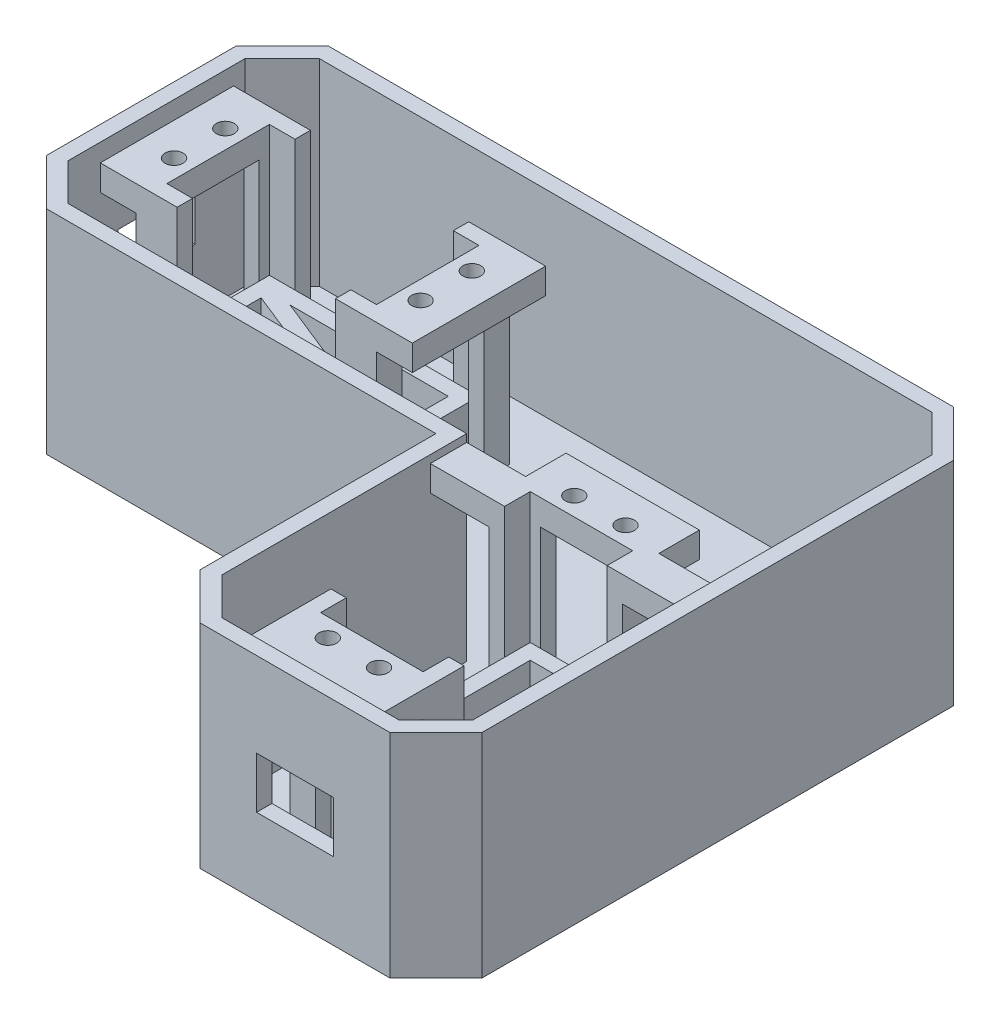
from build123d import *

# Parameters (mm, degrees)
BOSS_EXTRUDE1_DEPTH     = 55
SHELL1_START            = 3
SHELL1_DEPTH            = 49
CUT_EXTRUDE1_DEPTH      = 161.15617378
CUT_EXTRUDE1_DEPTH_BACK = 161.15617378
SKETCH4_W               = 154.651671352
SKETCH4_H               = 22.597591031
SKETCH6_R               = 3.8
BOSS_EXTRUDE2_DEPTH     = 6
BOSS_EXTRUDE3_DEPTH     = 37
SKETCH9_W               = 26
SKETCH9_H               = 10
BOSS_EXTRUDE4_DEPTH     = 5
CUT_EXTRUDE3_REACH      = 159.293
SKETCH10_R              = 1.75
SKETCH11_W              = 26
SKETCH11_H              = 2
SKETCH11_W_2            = 11.5
SKETCH11_H_2            = 7.1
BOSS_EXTRUDE5_DEPTH     = 5
CUT_EXTRUDE4_REACH      = 184.818
SKETCH12_W              = 15
SKETCH12_H              = 10
SKETCH13_W              = 20
SKETCH13_H              = 40.9
BOSS_EXTRUDE6_DEPTH     = 11.5
CUT_EXTRUDE5_DEPTH      = 11.5
BOSS_EXTRUDE7_DEPTH     = 11.5
CUT_EXTRUDE6_REACH      = 158.036
SKETCH16_W              = 15
SKETCH16_H              = 10
BOSS_EXTRUDE8_DEPTH     = 37
BOSS_EXTRUDE9_DEPTH     = 5
SKETCH20_W              = 40.9
SKETCH20_H              = 20
BOSS_EXTRUDE10_DEPTH    = 11.5
CUT_EXTRUDE7_DEPTH      = 11.5


# Read off the part's stored shape, not the designer's step: Shell1
with BuildPart() as part:
    # Sketch2 → Boss-Extrude1 (new body)
    with BuildSketch(Plane(origin=(0, 0, 0), x_dir=(1, 0, 0), z_dir=(0, 1, 0))):
        Polygon((9, 55), (0, 46), (0, 9), (9, 0), (85, 0), (140, 0), (140, 46), (131, 55), align=None)
        Polygon((140, 0), (85, 0), (85, -46), (94, -55), (131, -55), (140, -46), align=None)
    extrude(amount=BOSS_EXTRUDE1_DEPTH)

    # Shell1 outline → Shell1 (cut)
    with BuildSketch(Plane(origin=(0, 0, 0), x_dir=(1, 0, 0), z_dir=(0, 1, 0)).offset(SHELL1_START)):
        Polygon((10.242640687, 3), (88, 3), (88, -44.757359313), (95.242640687, -52), (129.757359313, -52), (137, -44.757359313), (137, 44.757359313), (129.757359313, 52), (10.242640687, 52), (3, 44.757359313), (3, 10.242640687), align=None)
    extrude(amount=SHELL1_DEPTH, mode=Mode.SUBTRACT)

    # Sketch4 → Cut-Extrude1 (cut, two sides: drawn at the far end of the back side and taken through both)
    with BuildSketch(Plane.XY.offset(-CUT_EXTRUDE1_DEPTH_BACK)):
        with Locations((70, 52.798795516)):
            Rectangle(SKETCH4_W, SKETCH4_H)
    extrude(amount=CUT_EXTRUDE1_DEPTH + CUT_EXTRUDE1_DEPTH_BACK, mode=Mode.SUBTRACT)

    # Sketch6 → Boss-Extrude2 (add)
    with BuildSketch(Plane.XZ):
        with Locations(Location((112.5, 30, 0), (0, 0, 270))):
            Circle(SKETCH6_R)
    extrude(amount=BOSS_EXTRUDE2_DEPTH)

    # Sketch8 → Boss-Extrude3 (add)
    with BuildSketch(Plane(origin=(0, 3, 0), x_dir=(1, 0, 0), z_dir=(0, 1, 0))):
        Polygon((102.5, -35), (99.5, -35), (99.5, -43), (104.5, -43), (104.5, -40), (102.5, -40), align=None)
        Polygon((99.5, 3.9), (99.5, -4.1), (102.5, -4.1), (102.5, 0.9), (104.5, 0.9), (104.5, 3.9), align=None)
        Polygon((120.5, -40), (120.5, -43), (125.5, -43), (125.5, -35), (122.5, -35), (122.5, -40), align=None)
        Polygon((125.5, 3.9), (120.5, 3.9), (120.5, 0.9), (122.5, 0.9), (122.5, -4.1), (125.5, -4.1), align=None)
    extrude(amount=BOSS_EXTRUDE3_DEPTH)

    # Sketch9 → Boss-Extrude4 (add)
    with BuildSketch(Plane(origin=(0, 40, 0), x_dir=(1, 0, 0), z_dir=(0, 1, 0))):
        with Locations((112.5, 5.9)):
            Rectangle(SKETCH9_W, SKETCH9_H)
        with Locations((112.5, -45)):
            Rectangle(SKETCH9_W, SKETCH9_H)
    extrude(amount=-BOSS_EXTRUDE4_DEPTH)

    # Sketch10 → Cut-Extrude3 (cut, up to next)
    with BuildSketch(Plane(origin=(0, 40, 0), x_dir=(1, 0, 0), z_dir=(0, 1, 0)), mode=Mode.PRIVATE) as cut_extrude3_sk1:
        with Locations(Location((107.5, 4.5, 0), (0, 0, 270))):
            Circle(SKETCH10_R)
    cut_extrude3_tool1 = extrude(cut_extrude3_sk1.sketch, amount=-CUT_EXTRUDE3_REACH, mode=Mode.PRIVATE) & part.part
    # Sketch10 → Cut-Extrude3 (cut, up to next)
    with BuildSketch(Plane(origin=(0, 40, 0), x_dir=(1, 0, 0), z_dir=(0, 1, 0)), mode=Mode.PRIVATE) as cut_extrude3_sk2:
        with Locations(Location((117.5, 4.5, 0), (0, 0, 270))):
            Circle(SKETCH10_R)
    cut_extrude3_tool2 = extrude(cut_extrude3_sk2.sketch, amount=-CUT_EXTRUDE3_REACH, mode=Mode.PRIVATE) & part.part
    # Sketch10 → Cut-Extrude3 (cut, up to next)
    with BuildSketch(Plane(origin=(0, 40, 0), x_dir=(1, 0, 0), z_dir=(0, 1, 0)), mode=Mode.PRIVATE) as cut_extrude3_sk3:
        with Locations(Location((117.5, -43.6, 0), (0, 0, 270))):
            Circle(SKETCH10_R)
    cut_extrude3_tool3 = extrude(cut_extrude3_sk3.sketch, amount=-CUT_EXTRUDE3_REACH, mode=Mode.PRIVATE) & part.part
    # Sketch10 → Cut-Extrude3 (cut, up to next)
    with BuildSketch(Plane(origin=(0, 40, 0), x_dir=(1, 0, 0), z_dir=(0, 1, 0)), mode=Mode.PRIVATE) as cut_extrude3_sk4:
        with Locations(Location((107.5, -43.6, 0), (0, 0, 90))):
            Circle(SKETCH10_R)
    cut_extrude3_tool4 = extrude(cut_extrude3_sk4.sketch, amount=-CUT_EXTRUDE3_REACH, mode=Mode.PRIVATE) & part.part
    add(cut_extrude3_tool1.solids().sort_by_distance((107.5, 40, -4.5))[0], mode=Mode.SUBTRACT)
    add(cut_extrude3_tool2.solids().sort_by_distance((117.5, 40, -4.5))[0], mode=Mode.SUBTRACT)
    add(cut_extrude3_tool3.solids().sort_by_distance((117.5, 40, 43.6))[0], mode=Mode.SUBTRACT)
    add(cut_extrude3_tool4.solids().sort_by_distance((107.5, 40, 43.6))[0], mode=Mode.SUBTRACT)

    # Sketch11 → Boss-Extrude5 (add)
    with BuildSketch(Plane(origin=(0, 40, 0), x_dir=(1, 0, 0), z_dir=(0, 1, 0))):
        with Locations((112.5, -51)):
            Rectangle(SKETCH11_W, SKETCH11_H)
        with Locations((93.75, -0.55)):
            Rectangle(SKETCH11_W_2, SKETCH11_H_2)
        with Locations((131.25, -0.55)):
            Rectangle(SKETCH11_W_2, SKETCH11_H_2)
    extrude(amount=-BOSS_EXTRUDE5_DEPTH)

    # Sketch12 → Cut-Extrude4 (cut, up to next)
    with BuildSketch(Plane.XY.offset(55), mode=Mode.PRIVATE) as cut_extrude4_sk1:
        with Locations((112.5, 20)):
            Rectangle(SKETCH12_W, SKETCH12_H)
    cut_extrude4_tool1 = extrude(cut_extrude4_sk1.sketch, amount=-CUT_EXTRUDE4_REACH, mode=Mode.PRIVATE) & part.part
    add(cut_extrude4_tool1.solids().sort_by_distance((112.5, 20, 55))[0], mode=Mode.SUBTRACT)

    # Sketch13 → Boss-Extrude6 (add)
    with BuildSketch(Plane(origin=(0, 3, 0), x_dir=(1, 0, 0), z_dir=(0, 1, 0))):
        with Locations((112.5, -19.55)):
            Rectangle(SKETCH13_W, SKETCH13_H)
    extrude(amount=BOSS_EXTRUDE6_DEPTH)

    # Sketch14 → Cut-Extrude5 (cut)
    with BuildSketch(Plane(origin=(0, 14.5, 0), x_dir=(1, 0, 0), z_dir=(0, 1, 0))):
        Polygon((105.5, -2.1), (105.5, -4.1), (105.5, -35), (105.5, -37), (119.5, -37), (119.5, -35), (119.5, -4.1), (119.5, -2.1), align=None)
    extrude(amount=-CUT_EXTRUDE5_DEPTH, mode=Mode.SUBTRACT)

    # Sketch15 → Boss-Extrude7 (add)
    with BuildSketch(Plane(origin=(0, 3, 0), x_dir=(1, 0, 0), z_dir=(0, 1, 0))):
        Polygon((112.5, -19.55), (119.5, -2.1), (117.883811276, -2.1), (111.107835851, -18.991538737), align=None)
        Polygon((119.5, -6.128927606), (119.5, -2.1), (112.5, -19.55), (113.892164149, -20.108461263), align=None)
        Polygon((105.5, -37), (112.5, -19.55), (111.107835851, -18.991538737), (105.5, -32.971072394), align=None)
        Polygon((113.892164149, -20.108461263), (112.5, -19.55), (105.5, -37), (107.116188724, -37), align=None)
    extrude(amount=BOSS_EXTRUDE7_DEPTH)

    # Sketch16 → Cut-Extrude6 (cut, up to next)
    with BuildSketch(Plane.ZY, mode=Mode.PRIVATE) as cut_extrude6_sk1:
        with Locations((-27.5, 20)):
            Rectangle(SKETCH16_W, SKETCH16_H)
    cut_extrude6_tool1 = extrude(cut_extrude6_sk1.sketch, amount=-CUT_EXTRUDE6_REACH, mode=Mode.PRIVATE) & part.part
    add(cut_extrude6_tool1.solids().sort_by_distance((0, 20, -27.5))[0], mode=Mode.SUBTRACT)

    # Sketch18 → Boss-Extrude8 (add)
    with BuildSketch(Plane(origin=(0, 3, 0), x_dir=(1, 0, 0), z_dir=(0, 1, 0))):
        Polygon((15, 37.5), (20, 37.5), (20, 40.5), (12, 40.5), (12, 35.5), (15, 35.5), align=None)
        Polygon((55.9, 37.5), (55.9, 35.5), (58.9, 35.5), (58.9, 40.5), (50.9, 40.5), (50.9, 37.5), align=None)
        Polygon((55.9, 19.5), (55.9, 17.5), (50.9, 17.5), (50.9, 14.5), (58.9, 14.5), (58.9, 19.5), align=None)
        Polygon((20, 14.5), (20, 17.5), (15, 17.5), (15, 19.5), (12, 19.5), (12, 14.5), align=None)
    extrude(amount=BOSS_EXTRUDE8_DEPTH)

    # Sketch19 → Boss-Extrude9 (add)
    # profile 1 of 3: a face of its own
    with BuildSketch(Plane(origin=(0, 40, 0), x_dir=(1, 0, 0), z_dir=(0, 1, 0))):
        Polygon((12, 35.5), (12, 40.5), (5, 40.5), (5, 14.5), (12, 14.5), (12, 19.5), (15, 19.5), (15, 35.5), align=None)
        with BuildLine():
            ThreePointArc((13.15, 22.5), (10.162563133, 21.262563133), (11.4, 24.25))
            ThreePointArc((11.4, 24.25), (12.637436867, 23.737436867), (13.15, 22.5))
        make_face(mode=Mode.SUBTRACT)
        with BuildLine():
            ThreePointArc((13.15, 32.5), (12.637436867, 31.262563133), (11.4, 30.75))
            ThreePointArc((11.4, 30.75), (10.162563133, 33.737436867), (13.15, 32.5))
        make_face(mode=Mode.SUBTRACT)
    # profile 2 of 3: a face of its own
    with BuildSketch(Plane(origin=(0, 40, 0), x_dir=(1, 0, 0), z_dir=(0, 1, 0))):
        Polygon((15, 37.5), (15, 40.5), (12, 40.5), (12, 35.5), (15, 35.5), align=None)
    # profile 3 of 3: a face of its own
    with BuildSketch(Plane(origin=(0, 40, 0), x_dir=(1, 0, 0), z_dir=(0, 1, 0))):
        Polygon((58.9, 19.5), (58.9, 14.5), (65.9, 14.5), (65.9, 40.5), (58.9, 40.5), (58.9, 35.5), (55.9, 35.5), (55.9, 19.5), align=None)
        with BuildLine():
            ThreePointArc((61.25, 22.5), (58.262563133, 21.262563133), (59.5, 24.25))
            ThreePointArc((59.5, 24.25), (60.737436867, 23.737436867), (61.25, 22.5))
        make_face(mode=Mode.SUBTRACT)
        with BuildLine():
            ThreePointArc((61.25, 32.5), (60.737436867, 31.262563133), (59.5, 30.75))
            ThreePointArc((59.5, 30.75), (58.262563133, 33.737436867), (61.25, 32.5))
        make_face(mode=Mode.SUBTRACT)
    extrude(amount=-BOSS_EXTRUDE9_DEPTH)

    # Sketch20 → Boss-Extrude10 (add)
    with BuildSketch(Plane(origin=(0, 3, 0), x_dir=(1, 0, 0), z_dir=(0, 1, 0))):
        with Locations((35.45, 27.5)):
            Rectangle(SKETCH20_W, SKETCH20_H)
    extrude(amount=BOSS_EXTRUDE10_DEPTH)

    # Sketch21 → Cut-Extrude7 (cut)
    with BuildSketch(Plane(origin=(0, 14.5, 0), x_dir=(1, 0, 0), z_dir=(0, 1, 0))):
        Polygon((18, 32.883811276), (18, 20.5), (48.871072394, 20.5), (34.891538737, 26.107835851), align=None)
        Polygon((52.9, 34.5), (22.028927606, 34.5), (36.008461263, 28.892164149), (52.9, 22.116188724), align=None)
    extrude(amount=-CUT_EXTRUDE7_DEPTH, mode=Mode.SUBTRACT)


solid = part.part
